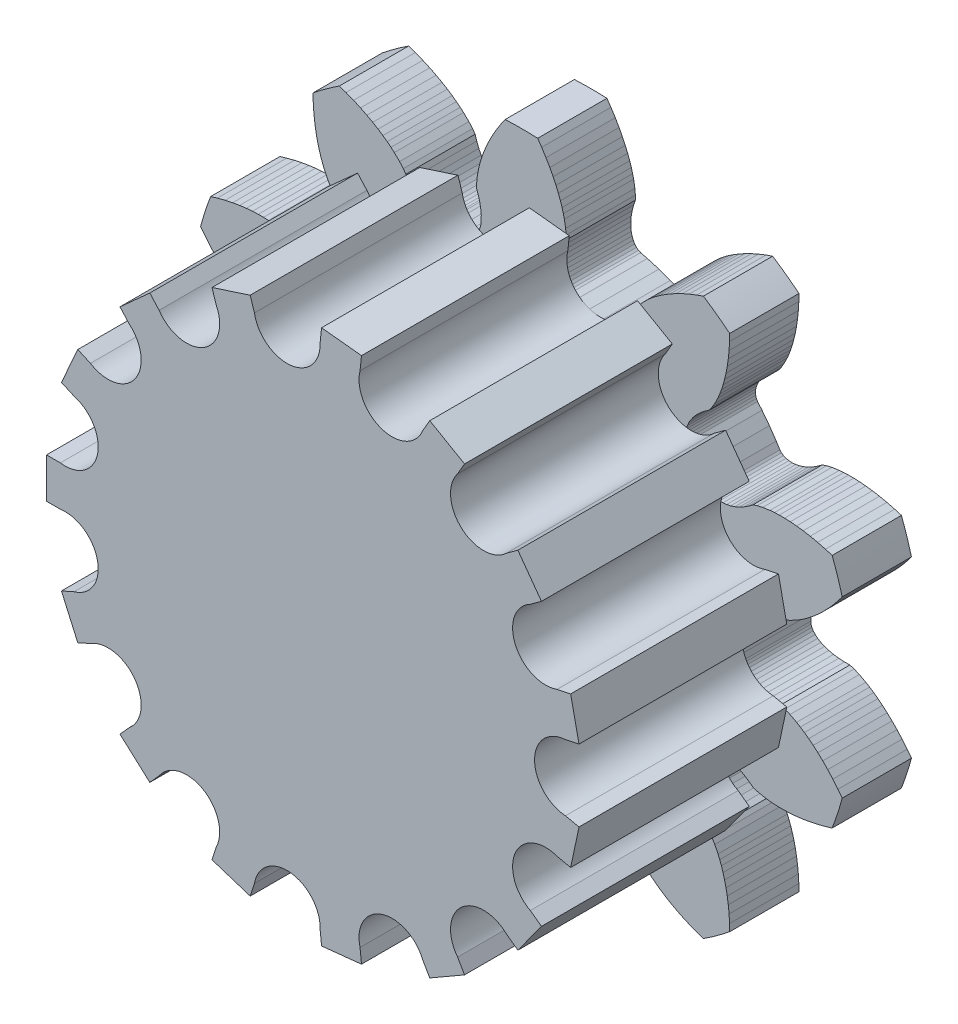
from build123d import *

# Parameters (mm, degrees)
MODEL_R             = 0.5
BOSS_EXTRUDE1_DEPTH = 5
SKETCH2_R           = 11
CUT_EXTRUDE1_DEPTH  = 87.698944957
BOSS_EXTRUDE2_DEPTH = 15
SKETCH4_R           = 8
CUT_EXTRUDE2_DEPTH  = 6


with BuildPart() as part:
    # Model → Boss-Extrude1 (new body)
    with BuildSketch(Plane.XY):
        with BuildLine():
            Line((45.0072197, -17.6135177), (44.9713648, -18.1935982))
            Line((44.9713648, -18.1935982), (44.960078413, -18.702780784))
            ThreePointArc((44.960078413, -18.702780784), (45.893236682, -19.416293937), (46.860189796, -20.083292477))
            Line((46.860189796, -20.083292477), (47.3409636, -19.9152125))
            Line((47.3409636, -19.9152125), (47.8815731, -19.7018577))
            Line((47.8815731, -19.7018577), (48.3832652, -19.4791595))
            Line((48.3832652, -19.4791595), (48.8442917, -19.2509448))
            Line((48.8442917, -19.2509448), (49.2681476, -19.0185598))
            Line((49.2681476, -19.0185598), (49.652488, -18.7863735))
            Line((49.652488, -18.7863735), (49.999784, -18.5561983))
            Line((49.999784, -18.5561983), (50.3097144, -18.3315784))
            Line((50.3097144, -18.3315784), (50.584246, -18.1145512))
            Line((50.584246, -18.1145512), (50.8253064, -17.9070155))
            Line((50.8253064, -17.9070155), (51.2090617, -17.5331754))
            Line((51.2090617, -17.5331754), (51.4736068, -17.2287023))
            Line((51.4736068, -17.2287023), (51.6609452, -16.9687186))
            Line((51.6609452, -16.9687186), (51.7766666, -16.5968373))
            Line((51.7766666, -16.5968373), (51.926219, -16.211607))
            Line((51.926219, -16.211607), (52.09214, -15.8680652))
            Line((52.09214, -15.8680652), (52.2711992, -15.5668343))
            Line((52.2711992, -15.5668343), (52.4601462, -15.3083721))
            Line((52.4601462, -15.3083721), (52.655719, -15.092912))
            Line((52.655719, -15.092912), (52.8546606, -14.9204789))
            Line((52.8546606, -14.9204789), (53.053697, -14.7909236))
            Line((53.053697, -14.7909236), (53.2496281, -14.7039005))
            Line((53.2496281, -14.7039005), (53.4392401, -14.6588488))
            Line((53.4392401, -14.6588488), (53.6193745, -14.6550368))
            Line((53.6193745, -14.6550368), (53.7869408, -14.6915235))
            Line((53.7869408, -14.6915235), (54.2459233, -14.875985))
            Line((54.2459233, -14.875985), (55.0711789, -15.1693514))
            Line((55.0711789, -15.1693514), (55.9112613, -15.4170861))
            Line((55.9112613, -15.4170861), (56.3910096, -15.5376367))
            Line((56.3910096, -15.5376367), (56.5480199, -15.6066114))
            Line((56.5480199, -15.6066114), (56.6915111, -15.7155757))
            Line((56.6915111, -15.7155757), (56.8184297, -15.8634744))
            Line((56.8184297, -15.8634744), (56.9257904, -16.0490431))
            Line((56.9257904, -16.0490431), (57.0106635, -16.2708461))
            Line((57.0106635, -16.2708461), (57.070257, -16.5272824))
            Line((57.070257, -16.5272824), (57.1018345, -16.8165481))
            Line((57.1018345, -16.8165481), (57.1027755, -17.1367086))
            Line((57.1027755, -17.1367086), (57.0705784, -17.485658))
            Line((57.0705784, -17.485658), (57.0028826, -17.861115))
            Line((57.0028826, -17.861115), (56.8974402, -18.2606775))
            Line((56.8974402, -18.2606775), (56.7724745, -18.6295551))
            Line((56.7724745, -18.6295551), (56.7712199, -18.9500011))
            Line((56.7712199, -18.9500011), (56.8062766, -19.3518207))
            Line((56.8062766, -19.3518207), (56.8970034, -19.8798294))
            Line((56.8970034, -19.8798294), (56.9700389, -20.1894211))
            Line((56.9700389, -20.1894211), (57.0645743, -20.5263654))
            Line((57.0645743, -20.5263654), (57.183285, -20.8902593))
            Line((57.183285, -20.8902593), (57.3289597, -21.2806104))
            Line((57.3289597, -21.2806104), (57.503422, -21.6943627))
            Line((57.503422, -21.6943627), (57.7097362, -22.1315024))
            Line((57.7097362, -22.1315024), (57.9485732, -22.5871164))
            Line((57.9485732, -22.5871164), (58.2235519, -23.0621703))
            Line((58.2235519, -23.0621703), (58.5355074, -23.5525403))
            Line((58.5355074, -23.5525403), (58.82566651, -23.971111584))
            ThreePointArc((58.82566651, -23.971111584), (59.999999958, -23.9998592), (61.174333407, -23.971111588))
            Line((61.174333407, -23.971111588), (61.4644926, -23.5525403))
            Line((61.4644926, -23.5525403), (61.7764481, -23.0621703))
            Line((61.7764481, -23.0621703), (62.0514268, -22.5871164))
            Line((62.0514268, -22.5871164), (62.2902638, -22.1315024))
            Line((62.2902638, -22.1315024), (62.496578, -21.6943627))
            Line((62.496578, -21.6943627), (62.6710403, -21.2806104))
            Line((62.6710403, -21.2806104), (62.816715, -20.8902593))
            Line((62.816715, -20.8902593), (62.9354257, -20.5263654))
            Line((62.9354257, -20.5263654), (63.0299611, -20.1894211))
            Line((63.0299611, -20.1894211), (63.1029966, -19.8798294))
            Line((63.1029966, -19.8798294), (63.1937234, -19.3518207))
            Line((63.1937234, -19.3518207), (63.2287801, -18.9500011))
            Line((63.2287801, -18.9500011), (63.2275255, -18.6295551))
            Line((63.2275255, -18.6295551), (63.1025598, -18.2606775))
            Line((63.1025598, -18.2606775), (62.9971174, -17.861115))
            Line((62.9971174, -17.861115), (62.9294216, -17.485658))
            Line((62.9294216, -17.485658), (62.8972245, -17.1367086))
            Line((62.8972245, -17.1367086), (62.8981655, -16.8165481))
            Line((62.8981655, -16.8165481), (62.929743, -16.5272824))
            Line((62.929743, -16.5272824), (62.9893365, -16.2708461))
            Line((62.9893365, -16.2708461), (63.0742096, -16.0490431))
            Line((63.0742096, -16.0490431), (63.1815703, -15.8634744))
            Line((63.1815703, -15.8634744), (63.3084889, -15.7155757))
            Line((63.3084889, -15.7155757), (63.4519801, -15.6066114))
            Line((63.4519801, -15.6066114), (63.6089904, -15.5376367))
            Line((63.6089904, -15.5376367), (64.0887387, -15.4170861))
            Line((64.0887387, -15.4170861), (64.9288211, -15.1693514))
            Line((64.9288211, -15.1693514), (65.7540767, -14.875985))
            Line((65.7540767, -14.875985), (66.2130592, -14.6915235))
            Line((66.2130592, -14.6915235), (66.3806255, -14.6550368))
            Line((66.3806255, -14.6550368), (66.5607599, -14.6588488))
            Line((66.5607599, -14.6588488), (66.7503719, -14.7039005))
            Line((66.7503719, -14.7039005), (66.946303, -14.7909236))
            Line((66.946303, -14.7909236), (67.1453394, -14.9204789))
            Line((67.1453394, -14.9204789), (67.344281, -15.092912))
            Line((67.344281, -15.092912), (67.5398538, -15.3083721))
            Line((67.5398538, -15.3083721), (67.7288008, -15.5668343))
            Line((67.7288008, -15.5668343), (67.90786, -15.8680652))
            Line((67.90786, -15.8680652), (68.073781, -16.211607))
            Line((68.073781, -16.211607), (68.2233334, -16.5968373))
            Line((68.2233334, -16.5968373), (68.3390548, -16.9687186))
            Line((68.3390548, -16.9687186), (68.5263932, -17.2287023))
            Line((68.5263932, -17.2287023), (68.7909383, -17.5331754))
            Line((68.7909383, -17.5331754), (69.1746936, -17.9070155))
            Line((69.1746936, -17.9070155), (69.415754, -18.1145512))
            Line((69.415754, -18.1145512), (69.6902856, -18.3315784))
            Line((69.6902856, -18.3315784), (70.000216, -18.5561983))
            Line((70.000216, -18.5561983), (70.347512, -18.7863735))
            Line((70.347512, -18.7863735), (70.7318524, -19.0185598))
            Line((70.7318524, -19.0185598), (71.1557083, -19.2509448))
            Line((71.1557083, -19.2509448), (71.6167348, -19.4791595))
            Line((71.6167348, -19.4791595), (72.1184269, -19.7018577))
            Line((72.1184269, -19.7018577), (72.6590364, -19.9152125))
            Line((72.6590364, -19.9152125), (73.139810204, -20.083292477))
            ThreePointArc((73.139810204, -20.083292477), (74.106763318, -19.416293937), (75.039921587, -18.702780784))
            Line((75.039921587, -18.702780784), (75.0286352, -18.1935982))
            Line((75.0286352, -18.1935982), (74.9927803, -17.6135177))
            Line((74.9927803, -17.6135177), (74.9360131, -17.0675626))
            Line((74.9360131, -17.0675626), (74.8614331, -16.5585782))
            Line((74.8614331, -16.5585782), (74.7714004, -16.0836564))
            Line((74.7714004, -16.0836564), (74.6693459, -15.6463774))
            Line((74.6693459, -15.6463774), (74.5577566, -15.2449512))
            Line((74.5577566, -15.2449512), (74.4399041, -14.8807785))
            Line((74.4399041, -14.8807785), (74.318334, -14.5526184))
            Line((74.318334, -14.5526184), (74.1954475, -14.2592242))
            Line((74.1954475, -14.2592242), (73.9584913, -13.7787283))
            Line((73.9584913, -13.7787283), (73.7506692, -13.4330436))
            Line((73.7506692, -13.4330436), (73.5613007, -13.1745348))
            Line((73.5613007, -13.1745348), (73.2433805, -12.9495595))
            Line((73.2433805, -12.9495595), (72.9232189, -12.6882841))
            Line((72.9232189, -12.6882841), (72.6477637, -12.4243237))
            Line((72.6477637, -12.4243237), (72.4166084, -12.1609427))
            Line((72.4166084, -12.1609427), (72.2291841, -11.9013743))
            Line((72.2291841, -11.9013743), (72.0847047, -11.6487926))
            Line((72.0847047, -11.6487926), (71.9821874, -11.4063031))
            Line((71.9821874, -11.4063031), (71.9204786, -11.1769735))
            Line((71.9204786, -11.1769735), (71.8982608, -10.9637403))
            Line((71.8982608, -10.9637403), (71.9140074, -10.7694868))
            Line((71.9140074, -10.7694868), (71.9660466, -10.5969909))
            Line((71.9660466, -10.5969909), (72.0525282, -10.4489008))
            Line((72.0525282, -10.4489008), (72.369795, -10.0693844))
            Line((72.369795, -10.0693844), (72.9038211, -9.3751748))
            Line((72.9038211, -9.3751748), (73.3990305, -8.6527632))
            Line((73.3990305, -8.6527632), (73.6619313, -8.2337476))
            Line((73.6619313, -8.2337476), (73.776049, -8.1057363))
            Line((73.776049, -8.1057363), (73.9240214, -8.0029399))
            Line((73.9240214, -8.0029399), (74.1039014, -7.9279364))
            Line((74.1039014, -7.9279364), (74.313564, -7.8831741))
            Line((74.313564, -7.8831741), (74.5507384, -7.8709959))
            Line((74.5507384, -7.8709959), (74.8130393, -7.8935623))
            Line((74.8130393, -7.8935623), (75.0979052, -7.9529183))
            Line((75.0979052, -7.9529183), (75.4026868, -8.0509584))
            Line((75.4026868, -8.0509584), (75.7246079, -8.1894109))
            Line((75.7246079, -8.1894109), (76.0607696, -8.3698161))
            Line((76.0607696, -8.3698161), (76.4081926, -8.5935693))
            Line((76.4081926, -8.5935693), (76.7203996, -8.8264083))
            Line((76.7203996, -8.8264083), (77.0247741, -8.9266248))
            Line((77.0247741, -8.9266248), (77.4177604, -9.0174529))
            Line((77.4177604, -9.0174529), (77.9479626, -9.0943303))
            Line((77.9479626, -9.0943303), (78.2649711, -9.1205385))
            Line((78.2649711, -9.1205385), (78.6146371, -9.1347515))
            Line((78.6146371, -9.1347515), (78.9974044, -9.1343003))
            Line((78.9974044, -9.1343003), (79.4136663, -9.1163805))
            Line((79.4136663, -9.1163805), (79.86108, -9.0783135))
            Line((79.86108, -9.0783135), (80.3405791, -9.0171807))
            Line((80.3405791, -9.0171807), (80.8476985, -8.9308257))
            Line((80.8476985, -8.9308257), (81.3844747, -8.8161051))
            Line((81.3844747, -8.8161051), (81.9472438, -8.6709504))
            Line((81.9472438, -8.6709504), (82.434992789, -8.524338316))
            ThreePointArc((82.434992789, -8.524338316), (82.825222394, -7.416364364), (83.16077079, -6.290623409))
            Line((83.16077079, -6.290623409), (82.85235, -5.88532))
            Line((82.85235, -5.88532), (82.48238, -5.4371))
            Line((82.48238, -5.4371), (82.11555, -5.02878))
            Line((82.11555, -5.02878), (81.75604, -4.66084))
            Line((81.75604, -4.66084), (81.40405, -4.32954))
            Line((81.40405, -4.32954), (81.06446, -4.03576))
            Line((81.06446, -4.03576), (80.73823, -3.77659))
            Line((80.73823, -3.77659), (80.42883, -3.55124))
            Line((80.42883, -3.55124), (80.13759, -3.35721))
            Line((80.13759, -3.35721), (79.86572, -3.19208))
            Line((79.86572, -3.19208), (79.39159, -2.94263))
            Line((79.39159, -2.94263), (79.02027, -2.78512))
            Line((79.02027, -2.78512), (78.71512, -2.68729))
            Line((78.71512, -2.68729), (78.32568, -2.69215))
            Line((78.32568, -2.69215), (77.91309, -2.66896))
            Line((77.91309, -2.66896), (77.53509, -2.61732))
            Line((77.53509, -2.61732), (77.19327, -2.54011))
            Line((77.19327, -2.54011), (76.88907, -2.44028))
            Line((76.88907, -2.44028), (76.62372, -2.32086))
            Line((76.62372, -2.32086), (76.39825, -2.18494))
            Line((76.39825, -2.18494), (76.21353, -2.03568))
            Line((76.21353, -2.03568), (76.07022, -1.87623))
            Line((76.07022, -1.87623), (75.96878, -1.70982))
            Line((75.96878, -1.70982), (75.90949, -1.53968))
            Line((75.90949, -1.53968), (75.89241, -1.36904))
            Line((75.89241, -1.36904), (75.92601, -0.87552))
            Line((75.92601, -0.87552), (75.95, 0))
            Line((75.95, 0), (75.92601, 0.87552))
            Line((75.92601, 0.87552), (75.89241, 1.36904))
            Line((75.89241, 1.36904), (75.90949, 1.53968))
            Line((75.90949, 1.53968), (75.96878, 1.70982))
            Line((75.96878, 1.70982), (76.07022, 1.87623))
            Line((76.07022, 1.87623), (76.21353, 2.03568))
            Line((76.21353, 2.03568), (76.39825, 2.18494))
            Line((76.39825, 2.18494), (76.62372, 2.32086))
            Line((76.62372, 2.32086), (76.88907, 2.44028))
            Line((76.88907, 2.44028), (77.19327, 2.54011))
            Line((77.19327, 2.54011), (77.53509, 2.61732))
            Line((77.53509, 2.61732), (77.91309, 2.66896))
            Line((77.91309, 2.66896), (78.32568, 2.69215))
            Line((78.32568, 2.69215), (78.71512, 2.68729))
            Line((78.71512, 2.68729), (79.02027, 2.78512))
            Line((79.02027, 2.78512), (79.39159, 2.94263))
            Line((79.39159, 2.94263), (79.86572, 3.19208))
            Line((79.86572, 3.19208), (80.13759, 3.35721))
            Line((80.13759, 3.35721), (80.42883, 3.55124))
            Line((80.42883, 3.55124), (80.73823, 3.77659))
            Line((80.73823, 3.77659), (81.06446, 4.03576))
            Line((81.06446, 4.03576), (81.40405, 4.32954))
            Line((81.40405, 4.32954), (81.75604, 4.66084))
            Line((81.75604, 4.66084), (82.11555, 5.02878))
            Line((82.11555, 5.02878), (82.48238, 5.4371))
            Line((82.48238, 5.4371), (82.85235, 5.88532))
            Line((82.85235, 5.88532), (83.16077089, 6.290623409))
            ThreePointArc((83.16077089, 6.290623409), (82.825222494, 7.416364364), (82.434992889, 8.524338316))
            Line((82.434992889, 8.524338316), (81.9472438, 8.6709504))
            Line((81.9472438, 8.6709504), (81.3844747, 8.8161051))
            Line((81.3844747, 8.8161051), (80.8476985, 8.9308257))
            Line((80.8476985, 8.9308257), (80.3405791, 9.0171807))
            Line((80.3405791, 9.0171807), (79.86108, 9.0783135))
            Line((79.86108, 9.0783135), (79.4136663, 9.1163805))
            Line((79.4136663, 9.1163805), (78.9974044, 9.1343003))
            Line((78.9974044, 9.1343003), (78.6146371, 9.1347515))
            Line((78.6146371, 9.1347515), (78.2649711, 9.1205385))
            Line((78.2649711, 9.1205385), (77.9479626, 9.0943303))
            Line((77.9479626, 9.0943303), (77.4177604, 9.0174529))
            Line((77.4177604, 9.0174529), (77.0247741, 8.9266248))
            Line((77.0247741, 8.9266248), (76.7203996, 8.8264083))
            Line((76.7203996, 8.8264083), (76.4081926, 8.5935693))
            Line((76.4081926, 8.5935693), (76.0607696, 8.3698161))
            Line((76.0607696, 8.3698161), (75.7246079, 8.1894109))
            Line((75.7246079, 8.1894109), (75.4026868, 8.0509584))
            Line((75.4026868, 8.0509584), (75.0979052, 7.9529183))
            Line((75.0979052, 7.9529183), (74.8130393, 7.8935623))
            Line((74.8130393, 7.8935623), (74.5507384, 7.8709959))
            Line((74.5507384, 7.8709959), (74.313564, 7.8831741))
            Line((74.313564, 7.8831741), (74.1039014, 7.9279364))
            Line((74.1039014, 7.9279364), (73.9240214, 8.0029399))
            Line((73.9240214, 8.0029399), (73.776049, 8.1057363))
            Line((73.776049, 8.1057363), (73.6619313, 8.2337476))
            Line((73.6619313, 8.2337476), (73.3990305, 8.6527632))
            Line((73.3990305, 8.6527632), (72.9038211, 9.3751748))
            Line((72.9038211, 9.3751748), (72.369795, 10.0693844))
            Line((72.369795, 10.0693844), (72.0525282, 10.4489008))
            Line((72.0525282, 10.4489008), (71.9660466, 10.5969909))
            Line((71.9660466, 10.5969909), (71.9140074, 10.7694868))
            Line((71.9140074, 10.7694868), (71.8982608, 10.9637403))
            Line((71.8982608, 10.9637403), (71.9204786, 11.1769735))
            Line((71.9204786, 11.1769735), (71.9821874, 11.4063031))
            Line((71.9821874, 11.4063031), (72.0847047, 11.6487926))
            Line((72.0847047, 11.6487926), (72.2291841, 11.9013743))
            Line((72.2291841, 11.9013743), (72.4166084, 12.1609427))
            Line((72.4166084, 12.1609427), (72.6477637, 12.4243237))
            Line((72.6477637, 12.4243237), (72.9232189, 12.6882841))
            Line((72.9232189, 12.6882841), (73.2433805, 12.9495595))
            Line((73.2433805, 12.9495595), (73.5613007, 13.1745348))
            Line((73.5613007, 13.1745348), (73.7506692, 13.4330436))
            Line((73.7506692, 13.4330436), (73.9584913, 13.7787283))
            Line((73.9584913, 13.7787283), (74.1954475, 14.2592242))
            Line((74.1954475, 14.2592242), (74.318334, 14.5526184))
            Line((74.318334, 14.5526184), (74.4399041, 14.8807785))
            Line((74.4399041, 14.8807785), (74.5577566, 15.2449512))
            Line((74.5577566, 15.2449512), (74.6693459, 15.6463774))
            Line((74.6693459, 15.6463774), (74.7714004, 16.0836564))
            Line((74.7714004, 16.0836564), (74.8614331, 16.5585782))
            Line((74.8614331, 16.5585782), (74.9360131, 17.0675626))
            Line((74.9360131, 17.0675626), (74.9927803, 17.6135177))
            Line((74.9927803, 17.6135177), (75.0286352, 18.1935982))
            Line((75.0286352, 18.1935982), (75.039921587, 18.702780784))
            ThreePointArc((75.039921587, 18.702780784), (74.106763318, 19.416293937), (73.139810204, 20.083292477))
            Line((73.139810204, 20.083292477), (72.6590364, 19.9152125))
            Line((72.6590364, 19.9152125), (72.1184269, 19.7018577))
            Line((72.1184269, 19.7018577), (71.6167348, 19.4791595))
            Line((71.6167348, 19.4791595), (71.1557083, 19.2509448))
            Line((71.1557083, 19.2509448), (70.7318524, 19.0185598))
            Line((70.7318524, 19.0185598), (70.347512, 18.7863735))
            Line((70.347512, 18.7863735), (70.000216, 18.5561983))
            Line((70.000216, 18.5561983), (69.6902856, 18.3315784))
            Line((69.6902856, 18.3315784), (69.415754, 18.1145512))
            Line((69.415754, 18.1145512), (69.1746936, 17.9070155))
            Line((69.1746936, 17.9070155), (68.7909383, 17.5331754))
            Line((68.7909383, 17.5331754), (68.5263932, 17.2287023))
            Line((68.5263932, 17.2287023), (68.3390548, 16.9687186))
            Line((68.3390548, 16.9687186), (68.2233334, 16.5968373))
            Line((68.2233334, 16.5968373), (68.073781, 16.211607))
            Line((68.073781, 16.211607), (67.90786, 15.8680652))
            Line((67.90786, 15.8680652), (67.7288008, 15.5668343))
            Line((67.7288008, 15.5668343), (67.5398538, 15.3083721))
            Line((67.5398538, 15.3083721), (67.344281, 15.092912))
            Line((67.344281, 15.092912), (67.1453394, 14.9204789))
            Line((67.1453394, 14.9204789), (66.946303, 14.7909236))
            Line((66.946303, 14.7909236), (66.7503719, 14.7039005))
            Line((66.7503719, 14.7039005), (66.5607599, 14.6588488))
            Line((66.5607599, 14.6588488), (66.3806255, 14.6550368))
            Line((66.3806255, 14.6550368), (66.2130592, 14.6915235))
            Line((66.2130592, 14.6915235), (65.7540767, 14.875985))
            Line((65.7540767, 14.875985), (64.9288211, 15.1693514))
            Line((64.9288211, 15.1693514), (64.0887387, 15.4170861))
            Line((64.0887387, 15.4170861), (63.6089904, 15.5376367))
            Line((63.6089904, 15.5376367), (63.4519801, 15.6066114))
            Line((63.4519801, 15.6066114), (63.3084889, 15.7155757))
            Line((63.3084889, 15.7155757), (63.1815703, 15.8634744))
            Line((63.1815703, 15.8634744), (63.0742096, 16.0490431))
            Line((63.0742096, 16.0490431), (62.9893365, 16.2708461))
            Line((62.9893365, 16.2708461), (62.929743, 16.5272824))
            Line((62.929743, 16.5272824), (62.8981655, 16.8165481))
            Line((62.8981655, 16.8165481), (62.8972245, 17.1367086))
            Line((62.8972245, 17.1367086), (62.9294216, 17.485658))
            Line((62.9294216, 17.485658), (62.9971174, 17.861115))
            Line((62.9971174, 17.861115), (63.1025598, 18.2606775))
            Line((63.1025598, 18.2606775), (63.2275255, 18.6295551))
            Line((63.2275255, 18.6295551), (63.2287801, 18.9500011))
            Line((63.2287801, 18.9500011), (63.1937234, 19.3518207))
            Line((63.1937234, 19.3518207), (63.1029966, 19.8798294))
            Line((63.1029966, 19.8798294), (63.0299611, 20.1894211))
            Line((63.0299611, 20.1894211), (62.9354257, 20.5263654))
            Line((62.9354257, 20.5263654), (62.816715, 20.8902593))
            Line((62.816715, 20.8902593), (62.6710403, 21.2806104))
            Line((62.6710403, 21.2806104), (62.496578, 21.6943627))
            Line((62.496578, 21.6943627), (62.2902638, 22.1315024))
            Line((62.2902638, 22.1315024), (62.0514268, 22.5871164))
            Line((62.0514268, 22.5871164), (61.7764481, 23.0621703))
            Line((61.7764481, 23.0621703), (61.4644926, 23.5525403))
            Line((61.4644926, 23.5525403), (61.17433349, 23.971111584))
            ThreePointArc((61.17433349, 23.971111584), (60.000000042, 23.9998592), (58.825666593, 23.971111588))
            Line((58.825666593, 23.971111588), (58.5355074, 23.5525403))
            Line((58.5355074, 23.5525403), (58.2235519, 23.0621703))
            Line((58.2235519, 23.0621703), (57.9485732, 22.5871164))
            Line((57.9485732, 22.5871164), (57.7097362, 22.1315024))
            Line((57.7097362, 22.1315024), (57.503422, 21.6943627))
            Line((57.503422, 21.6943627), (57.3289597, 21.2806104))
            Line((57.3289597, 21.2806104), (57.183285, 20.8902593))
            Line((57.183285, 20.8902593), (57.0645743, 20.5263654))
            Line((57.0645743, 20.5263654), (56.9700389, 20.1894211))
            Line((56.9700389, 20.1894211), (56.8970034, 19.8798294))
            Line((56.8970034, 19.8798294), (56.8062766, 19.3518207))
            Line((56.8062766, 19.3518207), (56.7712199, 18.9500011))
            Line((56.7712199, 18.9500011), (56.7724745, 18.6295551))
            Line((56.7724745, 18.6295551), (56.8974402, 18.2606775))
            Line((56.8974402, 18.2606775), (57.0028826, 17.861115))
            Line((57.0028826, 17.861115), (57.0705784, 17.485658))
            Line((57.0705784, 17.485658), (57.1027755, 17.1367086))
            Line((57.1027755, 17.1367086), (57.1018345, 16.8165481))
            Line((57.1018345, 16.8165481), (57.070257, 16.5272824))
            Line((57.070257, 16.5272824), (57.0106635, 16.2708461))
            Line((57.0106635, 16.2708461), (56.9257904, 16.0490431))
            Line((56.9257904, 16.0490431), (56.8184297, 15.8634744))
            Line((56.8184297, 15.8634744), (56.6915111, 15.7155757))
            Line((56.6915111, 15.7155757), (56.5480199, 15.6066114))
            Line((56.5480199, 15.6066114), (56.3910096, 15.5376367))
            Line((56.3910096, 15.5376367), (55.9112613, 15.4170861))
            Line((55.9112613, 15.4170861), (55.0711789, 15.1693514))
            Line((55.0711789, 15.1693514), (54.2459233, 14.875985))
            Line((54.2459233, 14.875985), (53.7869408, 14.6915235))
            Line((53.7869408, 14.6915235), (53.6193745, 14.6550368))
            Line((53.6193745, 14.6550368), (53.4392401, 14.6588488))
            Line((53.4392401, 14.6588488), (53.2496281, 14.7039005))
            Line((53.2496281, 14.7039005), (53.053697, 14.7909236))
            Line((53.053697, 14.7909236), (52.8546606, 14.9204789))
            Line((52.8546606, 14.9204789), (52.655719, 15.092912))
            Line((52.655719, 15.092912), (52.4601462, 15.3083721))
            Line((52.4601462, 15.3083721), (52.2711992, 15.5668343))
            Line((52.2711992, 15.5668343), (52.09214, 15.8680652))
            Line((52.09214, 15.8680652), (51.926219, 16.211607))
            Line((51.926219, 16.211607), (51.7766666, 16.5968373))
            Line((51.7766666, 16.5968373), (51.6609452, 16.9687186))
            Line((51.6609452, 16.9687186), (51.4736068, 17.2287023))
            Line((51.4736068, 17.2287023), (51.2090617, 17.5331754))
            Line((51.2090617, 17.5331754), (50.8253064, 17.9070155))
            Line((50.8253064, 17.9070155), (50.584246, 18.1145512))
            Line((50.584246, 18.1145512), (50.3097144, 18.3315784))
            Line((50.3097144, 18.3315784), (49.999784, 18.5561983))
            Line((49.999784, 18.5561983), (49.652488, 18.7863735))
            Line((49.652488, 18.7863735), (49.2681476, 19.0185598))
            Line((49.2681476, 19.0185598), (48.8442917, 19.2509448))
            Line((48.8442917, 19.2509448), (48.3832652, 19.4791595))
            Line((48.3832652, 19.4791595), (47.8815731, 19.7018577))
            Line((47.8815731, 19.7018577), (47.3409636, 19.9152125))
            Line((47.3409636, 19.9152125), (46.860189796, 20.083292477))
            ThreePointArc((46.860189796, 20.083292477), (45.893236682, 19.416293937), (44.960078413, 18.702780784))
            Line((44.960078413, 18.702780784), (44.9713648, 18.1935982))
            Line((44.9713648, 18.1935982), (45.0072197, 17.6135177))
            Line((45.0072197, 17.6135177), (45.0639869, 17.0675626))
            Line((45.0639869, 17.0675626), (45.1385669, 16.5585782))
            Line((45.1385669, 16.5585782), (45.2285996, 16.0836564))
            Line((45.2285996, 16.0836564), (45.3306541, 15.6463774))
            Line((45.3306541, 15.6463774), (45.4422434, 15.2449512))
            Line((45.4422434, 15.2449512), (45.5600959, 14.8807785))
            Line((45.5600959, 14.8807785), (45.681666, 14.5526184))
            Line((45.681666, 14.5526184), (45.8045525, 14.2592242))
            Line((45.8045525, 14.2592242), (46.0415087, 13.7787283))
            Line((46.0415087, 13.7787283), (46.2493308, 13.4330436))
            Line((46.2493308, 13.4330436), (46.4386993, 13.1745348))
            Line((46.4386993, 13.1745348), (46.7566195, 12.9495595))
            Line((46.7566195, 12.9495595), (47.0767811, 12.6882841))
            Line((47.0767811, 12.6882841), (47.3522363, 12.4243237))
            Line((47.3522363, 12.4243237), (47.5833916, 12.1609427))
            Line((47.5833916, 12.1609427), (47.7708159, 11.9013743))
            Line((47.7708159, 11.9013743), (47.9152953, 11.6487926))
            Line((47.9152953, 11.6487926), (48.0178126, 11.4063031))
            Line((48.0178126, 11.4063031), (48.0795214, 11.1769735))
            Line((48.0795214, 11.1769735), (48.1017392, 10.9637403))
            Line((48.1017392, 10.9637403), (48.0859926, 10.7694868))
            Line((48.0859926, 10.7694868), (48.0339534, 10.5969909))
            Line((48.0339534, 10.5969909), (47.9474718, 10.4489008))
            Line((47.9474718, 10.4489008), (47.630205, 10.0693844))
            Line((47.630205, 10.0693844), (47.0961789, 9.3751748))
            Line((47.0961789, 9.3751748), (46.6009695, 8.6527632))
            Line((46.6009695, 8.6527632), (46.3380687, 8.2337476))
            Line((46.3380687, 8.2337476), (46.223951, 8.1057363))
            Line((46.223951, 8.1057363), (46.0759786, 8.0029399))
            Line((46.0759786, 8.0029399), (45.8960986, 7.9279364))
            Line((45.8960986, 7.9279364), (45.686436, 7.8831741))
            Line((45.686436, 7.8831741), (45.4492616, 7.8709959))
            Line((45.4492616, 7.8709959), (45.1869607, 7.8935623))
            Line((45.1869607, 7.8935623), (44.9020948, 7.9529183))
            Line((44.9020948, 7.9529183), (44.5973132, 8.0509584))
            Line((44.5973132, 8.0509584), (44.2753921, 8.1894109))
            Line((44.2753921, 8.1894109), (43.9392304, 8.3698161))
            Line((43.9392304, 8.3698161), (43.5918074, 8.5935693))
            Line((43.5918074, 8.5935693), (43.2796004, 8.8264083))
            Line((43.2796004, 8.8264083), (42.9752259, 8.9266248))
            Line((42.9752259, 8.9266248), (42.5822396, 9.0174529))
            Line((42.5822396, 9.0174529), (42.0520374, 9.0943303))
            Line((42.0520374, 9.0943303), (41.7350289, 9.1205385))
            Line((41.7350289, 9.1205385), (41.3853629, 9.1347515))
            Line((41.3853629, 9.1347515), (41.0025956, 9.1343003))
            Line((41.0025956, 9.1343003), (40.5863337, 9.1163805))
            Line((40.5863337, 9.1163805), (40.13892, 9.0783135))
            Line((40.13892, 9.0783135), (39.6594209, 9.0171807))
            Line((39.6594209, 9.0171807), (39.1523015, 8.9308257))
            Line((39.1523015, 8.9308257), (38.6155253, 8.8161051))
            Line((38.6155253, 8.8161051), (38.0527562, 8.6709504))
            Line((38.0527562, 8.6709504), (37.565007211, 8.524338316))
            ThreePointArc((37.565007211, 8.524338316), (37.174777606, 7.416364364), (36.83922921, 6.290623409))
            Line((36.83922921, 6.290623409), (37.14765, 5.88532))
            Line((37.14765, 5.88532), (37.51762, 5.4371))
            Line((37.51762, 5.4371), (37.88445, 5.02878))
            Line((37.88445, 5.02878), (38.24396, 4.66084))
            Line((38.24396, 4.66084), (38.59595, 4.32954))
            Line((38.59595, 4.32954), (38.93554, 4.03576))
            Line((38.93554, 4.03576), (39.26177, 3.77659))
            Line((39.26177, 3.77659), (39.57117, 3.55124))
            Line((39.57117, 3.55124), (39.86241, 3.35721))
            Line((39.86241, 3.35721), (40.13428, 3.19208))
            Line((40.13428, 3.19208), (40.60841, 2.94263))
            Line((40.60841, 2.94263), (40.97973, 2.78512))
            Line((40.97973, 2.78512), (41.28488, 2.68729))
            Line((41.28488, 2.68729), (41.67432, 2.69215))
            Line((41.67432, 2.69215), (42.08691, 2.66896))
            Line((42.08691, 2.66896), (42.46491, 2.61732))
            Line((42.46491, 2.61732), (42.80673, 2.54011))
            Line((42.80673, 2.54011), (43.11093, 2.44028))
            Line((43.11093, 2.44028), (43.37628, 2.32086))
            Line((43.37628, 2.32086), (43.60175, 2.18494))
            Line((43.60175, 2.18494), (43.78647, 2.03568))
            Line((43.78647, 2.03568), (43.92978, 1.87623))
            Line((43.92978, 1.87623), (44.03122, 1.70982))
            Line((44.03122, 1.70982), (44.09051, 1.53968))
            Line((44.09051, 1.53968), (44.10759, 1.36904))
            Line((44.10759, 1.36904), (44.07399, 0.87552))
            Line((44.07399, 0.87552), (44.05, 0))
            Line((44.05, 0), (44.07399, -0.87552))
            Line((44.07399, -0.87552), (44.10759, -1.36904))
            Line((44.10759, -1.36904), (44.09051, -1.53968))
            Line((44.09051, -1.53968), (44.03122, -1.70982))
            Line((44.03122, -1.70982), (43.92978, -1.87623))
            Line((43.92978, -1.87623), (43.78647, -2.03568))
            Line((43.78647, -2.03568), (43.60175, -2.18494))
            Line((43.60175, -2.18494), (43.37628, -2.32086))
            Line((43.37628, -2.32086), (43.11093, -2.44028))
            Line((43.11093, -2.44028), (42.80673, -2.54011))
            Line((42.80673, -2.54011), (42.46491, -2.61732))
            Line((42.46491, -2.61732), (42.08691, -2.66896))
            Line((42.08691, -2.66896), (41.67432, -2.69215))
            Line((41.67432, -2.69215), (41.28488, -2.68729))
            Line((41.28488, -2.68729), (40.97973, -2.78512))
            Line((40.97973, -2.78512), (40.60841, -2.94263))
            Line((40.60841, -2.94263), (40.13428, -3.19208))
            Line((40.13428, -3.19208), (39.86241, -3.35721))
            Line((39.86241, -3.35721), (39.57117, -3.55124))
            Line((39.57117, -3.55124), (39.26177, -3.77659))
            Line((39.26177, -3.77659), (38.93554, -4.03576))
            Line((38.93554, -4.03576), (38.59595, -4.32954))
            Line((38.59595, -4.32954), (38.24396, -4.66084))
            Line((38.24396, -4.66084), (37.88445, -5.02878))
            Line((37.88445, -5.02878), (37.51762, -5.4371))
            Line((37.51762, -5.4371), (37.14765, -5.88532))
            Line((37.14765, -5.88532), (36.83922911, -6.290623409))
            ThreePointArc((36.83922911, -6.290623409), (37.174777506, -7.416364364), (37.565007111, -8.524338316))
            Line((37.565007111, -8.524338316), (38.0527562, -8.6709504))
            Line((38.0527562, -8.6709504), (38.6155253, -8.8161051))
            Line((38.6155253, -8.8161051), (39.1523015, -8.9308257))
            Line((39.1523015, -8.9308257), (39.6594209, -9.0171807))
            Line((39.6594209, -9.0171807), (40.13892, -9.0783135))
            Line((40.13892, -9.0783135), (40.5863337, -9.1163805))
            Line((40.5863337, -9.1163805), (41.0025956, -9.1343003))
            Line((41.0025956, -9.1343003), (41.3853629, -9.1347515))
            Line((41.3853629, -9.1347515), (41.7350289, -9.1205385))
            Line((41.7350289, -9.1205385), (42.0520374, -9.0943303))
            Line((42.0520374, -9.0943303), (42.5822396, -9.0174529))
            Line((42.5822396, -9.0174529), (42.9752259, -8.9266248))
            Line((42.9752259, -8.9266248), (43.2796004, -8.8264083))
            Line((43.2796004, -8.8264083), (43.5918074, -8.5935693))
            Line((43.5918074, -8.5935693), (43.9392304, -8.3698161))
            Line((43.9392304, -8.3698161), (44.2753921, -8.1894109))
            Line((44.2753921, -8.1894109), (44.5973132, -8.0509584))
            Line((44.5973132, -8.0509584), (44.9020948, -7.9529183))
            Line((44.9020948, -7.9529183), (45.1869607, -7.8935623))
            Line((45.1869607, -7.8935623), (45.4492616, -7.8709959))
            Line((45.4492616, -7.8709959), (45.686436, -7.8831741))
            Line((45.686436, -7.8831741), (45.8960986, -7.9279364))
            Line((45.8960986, -7.9279364), (46.0759786, -8.0029399))
            Line((46.0759786, -8.0029399), (46.223951, -8.1057363))
            Line((46.223951, -8.1057363), (46.3380687, -8.2337476))
            Line((46.3380687, -8.2337476), (46.6009695, -8.6527632))
            Line((46.6009695, -8.6527632), (47.0961789, -9.3751748))
            Line((47.0961789, -9.3751748), (47.630205, -10.0693844))
            Line((47.630205, -10.0693844), (47.9474718, -10.4489008))
            Line((47.9474718, -10.4489008), (48.0339534, -10.5969909))
            Line((48.0339534, -10.5969909), (48.0859926, -10.7694868))
            Line((48.0859926, -10.7694868), (48.1017392, -10.9637403))
            Line((48.1017392, -10.9637403), (48.0795214, -11.1769735))
            Line((48.0795214, -11.1769735), (48.0178126, -11.4063031))
            Line((48.0178126, -11.4063031), (47.9152953, -11.6487926))
            Line((47.9152953, -11.6487926), (47.7708159, -11.9013743))
            Line((47.7708159, -11.9013743), (47.5833916, -12.1609427))
            Line((47.5833916, -12.1609427), (47.3522363, -12.4243237))
            Line((47.3522363, -12.4243237), (47.0767811, -12.6882841))
            Line((47.0767811, -12.6882841), (46.7566195, -12.9495595))
            Line((46.7566195, -12.9495595), (46.4386993, -13.1745348))
            Line((46.4386993, -13.1745348), (46.2493308, -13.4330436))
            Line((46.2493308, -13.4330436), (46.0415087, -13.7787283))
            Line((46.0415087, -13.7787283), (45.8045525, -14.2592242))
            Line((45.8045525, -14.2592242), (45.681666, -14.5526184))
            Line((45.681666, -14.5526184), (45.5600959, -14.8807785))
            Line((45.5600959, -14.8807785), (45.4422434, -15.2449512))
            Line((45.4422434, -15.2449512), (45.3306541, -15.6463774))
            Line((45.3306541, -15.6463774), (45.2285996, -16.0836564))
            Line((45.2285996, -16.0836564), (45.1385669, -16.5585782))
            Line((45.1385669, -16.5585782), (45.0639869, -17.0675626))
            Line((45.0639869, -17.0675626), (45.0072197, -17.6135177))
        make_face()
        with Locations((60, 0)):
            Circle(MODEL_R, mode=Mode.SUBTRACT)
    extrude(amount=BOSS_EXTRUDE1_DEPTH)

    # Sketch2 → Cut-Extrude1 (cut, through all)
    with BuildSketch(Plane(origin=(0, 0, 0), x_dir=(-1, 0, 0), z_dir=(0, 0, -1))):
        with Locations((-60, 0)):
            Circle(SKETCH2_R)
    extrude(amount=-CUT_EXTRUDE1_DEPTH, mode=Mode.SUBTRACT)

    # Sketch3 → Boss-Extrude2 (add)
    with BuildSketch(Plane.XY.offset(5)):
        with BuildLine():
            Line((68.384885381, 17.422204495), (67.884885379, 16.556179093))
            ThreePointArc((67.884885379, 16.556179093), (64.9288211, 15.1693514), (63.352471745, 18.028849569))
            Line((63.352471745, 18.028849569), (63.457000211, 19.023371464))
            Line((63.457000211, 19.023371464), (60.573724982, 19.326415911))
            Line((60.573724982, 19.326415911), (60.469196515, 18.331894016))
            ThreePointArc((60.469196515, 18.331894016), (60.470598061, 18.284676528), (60.471065304, 18.237440554))
            ThreePointArc((60.471065304, 18.237440554), (58.285745011, 15.858151395), (55.729641582, 17.833746734))
            Line((55.729641582, 17.833746734), (55.420624591, 18.784803251))
            Line((55.420624591, 18.784803251), (52.663362321, 17.888914441))
            Line((52.663362321, 17.888914441), (52.972379312, 16.937857924))
            ThreePointArc((52.972379312, 16.937857924), (53.156489571, 16.423663502), (53.218948804, 15.881085088))
            ThreePointArc((53.218948804, 15.881085088), (51.523883745, 13.595907274), (48.845195185, 14.555027074))
            Line((48.845195185, 14.555027074), (48.176064581, 15.298171901))
            Line((48.176064581, 15.298171901), (46.021570966, 13.358257149))
            Line((46.021570966, 13.358257149), (46.69070157, 12.615112321))
            ThreePointArc((46.69070157, 12.615112321), (47.326142796, 11.792953309), (47.552226829, 10.778745736))
            ThreePointArc((47.552226829, 10.778745736), (46.317136903, 8.687552501), (43.889515878, 8.759611004))
            Line((43.889515878, 8.759611004), (42.975970422, 9.16634765))
            Line((42.975970422, 9.16634765), (41.796776981, 6.517835839))
            Line((41.796776981, 6.517835839), (42.710322437, 6.111099193))
            ThreePointArc((42.710322437, 6.111099193), (43.966536634, 5.254174319), (44.45072709, 3.812663323))
            ThreePointArc((44.45072709, 3.812663323), (43.625229074, 2.006849848), (41.719485636, 1.449578614))
            Line((41.719485636, 1.449578614), (40.719485636, 1.449578617))
            Line((40.719485636, 1.449578617), (40.719485627, -1.449578499))
            Line((40.719485627, -1.449578499), (41.719485627, -1.449578502))
            ThreePointArc((41.719485627, -1.449578502), (43.625229056, -2.006849744), (44.450727067, -3.812663214))
            ThreePointArc((44.450727067, -3.812663214), (43.966536606, -5.254174216), (42.7103224, -6.111099088))
            Line((42.7103224, -6.111099088), (41.796776941, -6.517835728))
            Line((41.796776941, -6.517835728), (42.975970366, -9.166347547))
            Line((42.975970366, -9.166347547), (43.889515825, -8.759610906))
            ThreePointArc((43.889515825, -8.759610906), (46.317136844, -8.687552414), (47.552226764, -10.778745645))
            ThreePointArc((47.552226764, -10.778745645), (47.326142727, -11.792953225), (46.690701493, -12.61511224))
            Line((46.690701493, -12.61511224), (46.021570884, -13.358257064))
            Line((46.021570884, -13.358257064), (48.176064487, -15.298171829))
            Line((48.176064487, -15.298171829), (48.845195096, -14.555027006))
            ThreePointArc((48.845195096, -14.555027006), (51.523883656, -13.59590722), (53.218948707, -15.881085032))
            ThreePointArc((53.218948707, -15.881085032), (53.156489473, -16.423663453), (52.972379209, -16.937857881))
            Line((52.972379209, -16.937857881), (52.663362212, -17.888914397))
            Line((52.663362212, -17.888914397), (55.420624476, -18.784803223))
            Line((55.420624476, -18.784803223), (55.729641473, -17.833746708))
            ThreePointArc((55.729641473, -17.833746708), (58.285744907, -15.858151384), (60.471065192, -18.237440542))
            ThreePointArc((60.471065192, -18.237440542), (60.47059795, -18.284676523), (60.469196404, -18.331894019))
            Line((60.469196404, -18.331894019), (60.573724864, -19.326415915))
            Line((60.573724864, -19.326415915), (63.457000095, -19.023371485))
            Line((63.457000095, -19.023371485), (63.352471635, -18.02884959))
            ThreePointArc((63.352471635, -18.02884959), (64.928821008, -15.16935143), (67.884885278, -16.556179141))
            Line((67.884885278, -16.556179141), (68.384885275, -17.422204546))
            Line((68.384885275, -17.422204546), (70.895628992, -15.972625996))
            Line((70.895628992, -15.972625996), (70.395628995, -15.10660059))
            ThreePointArc((70.395628995, -15.10660059), (70.672633121, -11.853159983), (73.937205856, -11.917750481))
            Line((73.937205856, -11.917750481), (74.746222848, -12.505535736))
            Line((74.746222848, -12.505535736), (76.450304652, -10.160068365))
            Line((76.450304652, -10.160068365), (75.64128766, -9.57228311))
            ThreePointArc((75.64128766, -9.57228311), (74.571050011, -6.487449493), (77.579656925, -5.218634494))
            Line((77.579656925, -5.218634494), (78.557804525, -5.426546187))
            Line((78.557804525, -5.426546187), (79.160573192, -2.590742612))
            Line((79.160573192, -2.590742612), (78.182425592, -2.382830918))
            ThreePointArc((78.182425592, -2.382830918), (75.949999979, -4.9e-08), (78.182425606, 2.382830807))
            Line((78.182425606, 2.382830807), (79.160573208, 2.590742495))
            Line((79.160573208, 2.590742495), (78.557804558, 5.426546074))
            Line((78.557804558, 5.426546074), (77.579656957, 5.218634387))
            ThreePointArc((77.579656957, 5.218634387), (74.57105005, 6.487449404), (75.641287718, 9.572283015))
            Line((75.641287718, 9.572283015), (76.450304714, 10.160068264))
            Line((76.450304714, 10.160068264), (74.746222924, 12.505535646))
            Line((74.746222924, 12.505535646), (73.937205928, 11.917750396))
            ThreePointArc((73.937205928, 11.917750396), (70.672633194, 11.853159918), (70.395629087, 15.106600527))
            Line((70.395629087, 15.106600527), (70.895629089, 15.972625929))
            Line((70.895629089, 15.972625929), (68.384885381, 17.422204495))
        make_face()
    extrude(amount=BOSS_EXTRUDE2_DEPTH)

    # Sketch4 → Cut-Extrude2 (cut)
    with BuildSketch(Plane(origin=(0, 0, 5), x_dir=(-1, 0, 0), z_dir=(0, 0, -1))):
        with Locations((-60, 0)):
            Circle(SKETCH4_R)
    extrude(amount=-CUT_EXTRUDE2_DEPTH, mode=Mode.SUBTRACT)


solid = part.part
